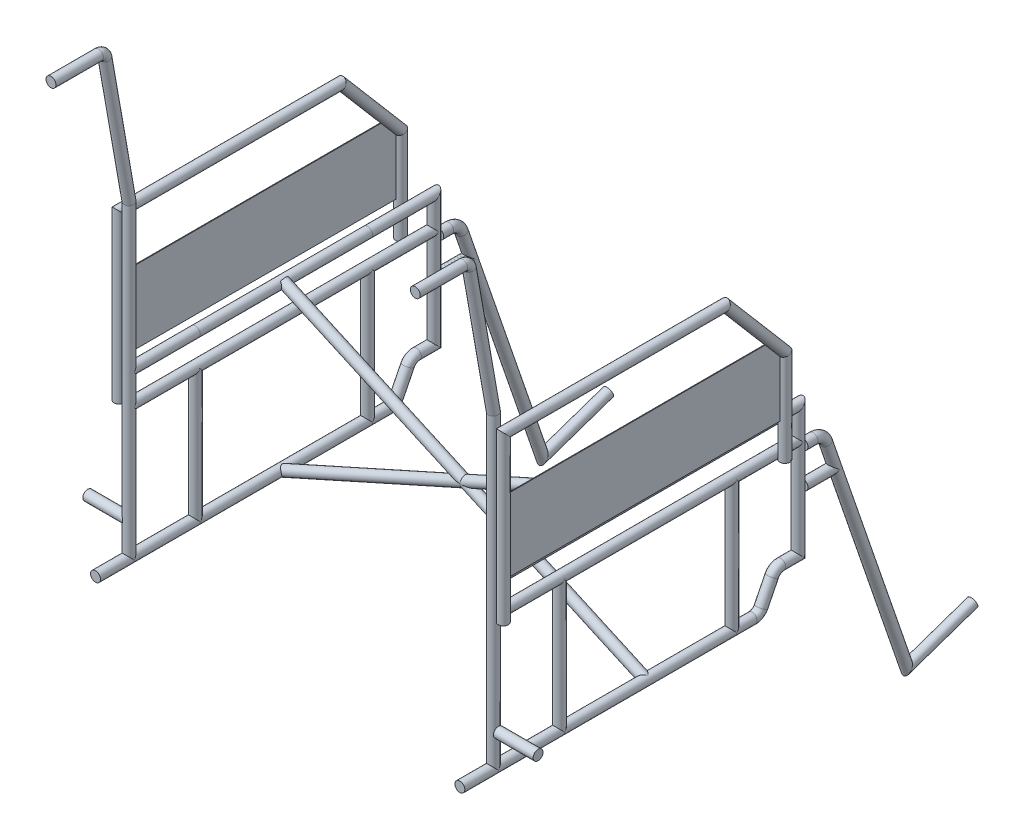
from build123d import *

# Parameters (mm, degrees)
VARREDURA1_PROFILE_R          = 7.5
RESSALTO_EXTRUS_O3_OUTLINE_R  = 7.537130279
RESSALTO_EXTRUS_O3_DEPTH      = 50.658102442
VARREDURA9_PROFILE_R          = 7.5
VARREDURA14_PROFILE_R         = 7.5
VARREDURA17_PROFILE_R         = 7.5
VARREDURA22_PROFILE_R         = 7.5
VARREDURA25_PROFILE_R         = 7.5
VARREDURA26_PROFILE_R         = 7.5
RESSALTO_EXTRUS_O5_DEPTH      = 0.55
RESSALTO_EXTRUS_O5_DEPTH_BACK = 0.55
VARREDURA28_PROFILE_R         = 7.5
VARREDURA29_PROFILE_R         = 7.5
VARREDURA37_PROFILE_R         = 7.5
VARREDURA38_PROFILE_R         = 7.5


with BuildPart() as part:
    # Varredura1: sweep along a path in Esboço1
    with BuildLine(Plane(origin=(0, 0, 0), x_dir=(0, 0, -1), z_dir=(1, 0, 0))) as varredura1_path:
        Line((0, 0), (100, 0))
        Line((100, 0), (360, 0))
        Line((360, 0), (390.738546016, 0))
        ThreePointArc((390.738546016, 0), (398.618936234, 2.236793114), (404.149086108, 8.280073331))
        Line((404.149086108, 8.280073331), (420.404466882, 40.719926669))
        ThreePointArc((420.404466882, 40.719926669), (425.934616757, 46.763206886), (433.815006974, 49))
        Line((433.815006974, 49), (460, 49))
        Line((460, 49), (460, 245))
        Line((460, 245), (360, 245))
        Line((360, 245), (100, 245))
        Line((100, 245), (0, 245))
        Line((0, 245), (0, 0))
    # Varredura1 profile (on start of the path) → Varredura1 (sweep)
    with BuildSketch(Plane(origin=(0, 0, 0), x_dir=(-1, 0, 0), z_dir=(0, 0, -1))):
        Circle(VARREDURA1_PROFILE_R)
    sweep(path=varredura1_path.line, transition=Transition.RIGHT)

    # Ressalto-extrusão3: read off the stored shape, not the designer's step
    # Ressalto-extrusão3 outline → Ressalto-extrusão3 (add)
    with BuildSketch(Plane.XY):
        Circle(RESSALTO_EXTRUS_O3_OUTLINE_R)
    extrude(amount=RESSALTO_EXTRUS_O3_DEPTH)

    # Varredura9: sweep along a path in Esboço6
    with BuildLine(Plane(origin=(0, 0, 0), x_dir=(0, 0, -1), z_dir=(1, 0, 0))) as varredura9_path:
        Line((100, 0), (100, 200.353309761))
    # Varredura9 profile (on start of the path) → Varredura9 (sweep)
    with BuildSketch(Plane(origin=(0, 0, -100), x_dir=(0, 0, 1), z_dir=(0, 1, 0))):
        Circle(VARREDURA9_PROFILE_R)
    sweep(path=varredura9_path.line)

    # Varredura14: sweep along a path in Esboço7
    with BuildLine(Plane(origin=(0, 0, 0), x_dir=(0, 0, -1), z_dir=(1, 0, 0))) as varredura14_path:
        Line((360, 0), (360, 200.014373302))
    # Varredura14 profile (on start of the path) → Varredura14 (sweep)
    with BuildSketch(Plane(origin=(0, 0, -360), x_dir=(0, 0, 1), z_dir=(0, 1, 0))):
        Circle(VARREDURA14_PROFILE_R)
    sweep(path=varredura14_path.line)

    # Varredura17: sweep along a path in Esboço242
    with BuildLine(Plane(origin=(0, 0, 0), x_dir=(0, 0, -1), z_dir=(1, 0, 0))) as varredura17_path:
        Line((0, 199.249020863), (459.296009098, 199.249020863))
    # Varredura17 profile (on start of the path) → Varredura17 (sweep)
    with BuildSketch(Plane(origin=(0, 199.249020863, 0), x_dir=(-1, 0, 0), z_dir=(0, 0, -1))):
        Circle(VARREDURA17_PROFILE_R)
    sweep(path=varredura17_path.line)

    # Varredura22: sweep along a path in Esboço279
    with BuildLine(Plane(origin=(0, 0, 0), x_dir=(0, 0, -1), z_dir=(1, 0, 0))) as varredura22_path:
        Line((0, 245), (0, 465))
        Line((0, 465), (-36.46611731, 671.809628133))
        ThreePointArc((-36.46611731, 671.809628133), (-39.886318743, 677.733590787), (-46.31419484, 680.073146356))
        Line((-46.31419484, 680.073146356), (-117.923198528, 680.073146356))
    # Varredura22 profile (on start of the path) → Varredura22 (sweep)
    with BuildSketch(Plane.ZX.offset(245)):
        Circle(VARREDURA22_PROFILE_R)
    sweep(path=varredura22_path.line, transition=Transition.RIGHT)


with BuildPart() as body_2:
    # Varredura25: sweep along a path in Esboço303
    with BuildLine(Plane(origin=(0, 0, 0), x_dir=(0, 0, -1), z_dir=(1, 0, 0))) as varredura25_path:
        Line((467.5, 136.031023838), (515.067041264, 136.031023838))
    # Varredura25 profile (on start of the path) → Varredura25 (sweep)
    with BuildSketch(Plane(origin=(0, 136.031023838, -467.5), x_dir=(-1, 0, 0), z_dir=(0, 0, -1))):
        Circle(VARREDURA25_PROFILE_R)
    sweep(path=varredura25_path.line)


with BuildPart() as body_3:
    # Varredura26: sweep along a path in Esboço294
    with BuildLine(Plane(origin=(15, 0, 0), x_dir=(0, 0, -1), z_dir=(1, 0, 0))) as varredura26_path:
        Line((424.987913504, 197.728542192), (424.987913504, 338.745926287))
        Line((424.987913504, 338.745926287), (334.34639884, 445))
        Line((334.34639884, 445), (0, 445))
        Line((0, 445), (0, 197.728542192))
    # Varredura26 profile (on start of the path) → Varredura26 (sweep)
    with BuildSketch(Plane(origin=(15, 197.728542192, -424.987913504), x_dir=(0, 0, 1), z_dir=(0, 1, 0))):
        Circle(VARREDURA26_PROFILE_R)
    sweep(path=varredura26_path.line, transition=Transition.RIGHT)


with BuildPart() as body_4:
    # Esboço325 → Ressalto-extrusão5 (new, two sides: drawn at the far end of the back side and taken through both)
    with BuildSketch(Plane(origin=(15, 0, 0), x_dir=(0, 0, -1), z_dir=(1, 0, 0)).offset(-RESSALTO_EXTRUS_O5_DEPTH_BACK)):
        Polygon((7.5, 362.571395037), (394.805064587, 362.571395037), (417.487913504, 335.981535967), (417.487913504, 251.998104881), (7.5, 252.5), align=None)
    extrude(amount=RESSALTO_EXTRUS_O5_DEPTH + RESSALTO_EXTRUS_O5_DEPTH_BACK)


with BuildPart() as body_5:
    # Corpo-Mover/Copiar1: read off the stored shape, not the designer's step
    # Corpo-Mover/Copiar1: copy of body 2
    add(body_2.part.moved(Location((-550, 0, 0))))


with BuildPart() as body_6:
    # Corpo-Mover_Copiar1 2: copy of part
    add(part.part.moved(Location((-550, 0, 0))))


with BuildPart() as part_1:
    add(part.part)

    add(body_6.part)  # Varredura28 merges body 6
    # Varredura28: sweep along a path in Esboço33
    with BuildLine(Plane.XY.offset(-230)) as varredura28_path:
        Line((0, 245.453414401), (-547.074890212, 0))
    # Varredura28 profile (on start of the path) → Varredura28 (sweep)
    with BuildSketch(Plane(origin=(0, 245.453414401, -230), x_dir=(0.40935159688576284, -0.9123767150289819, 0), z_dir=(-0.9123767150289819, -0.40935159688576284, 0))):
        Circle(VARREDURA28_PROFILE_R)
    sweep(path=varredura28_path.line)

    # Varredura29: sweep along a path in Esboço32
    with BuildLine(Plane.XY.offset(-230)) as varredura29_path:
        Line((0, 0), (-547.074890212, 246.861708637))
    # Varredura29 profile (on start of the path) → Varredura29 (sweep)
    with BuildSketch(Plane(origin=(0, 0, -230), x_dir=(-0.4113038774906765, -0.9114982832464001, 0), z_dir=(-0.9114982832464001, 0.4113038774906765, 0))):
        Circle(VARREDURA29_PROFILE_R)
    sweep(path=varredura29_path.line)


with BuildPart() as body_6_2:
    # Corpo-Mover/Copiar2: read off the stored shape, not the designer's step
    # Corpo-Mover/Copiar2: copy of body 4
    add(body_4.part.moved(Location((-580, 0, 0))))


with BuildPart() as body_7:
    # Corpo-Mover_Copiar2 2: copy of body 3
    add(body_3.part.moved(Location((-580, 0, 0))))


with BuildPart() as body_8:
    # Varredura37: sweep along a path in Esboço326
    with BuildLine(Plane.XY) as varredura37_path:
        Line((7.560028677, 50), (67.5, 50))
    # Varredura37 profile (on start of the path) → Varredura37 (sweep)
    with BuildSketch(Plane(origin=(7.560028677, 50, 0), x_dir=(0, 0, 1), z_dir=(1, 0, 0))):
        Circle(VARREDURA37_PROFILE_R)
    sweep(path=varredura37_path.line)


with BuildPart() as body_9:
    # Corpo-Mover/Copiar7: copy of body 8
    add(body_8.part.moved(Location((-620, 0, 0))))


with BuildPart() as body_2_1:
    add(body_2.part)

    # Varredura38: sweep along a path in Esboço302
    with BuildLine(Plane(origin=(0, 0, 0), x_dir=(0, 0, -1), z_dir=(1, 0, 0))) as varredura38_path:
        Line((467.5, 189.005412816), (482.576251784, 189.005412816))
        ThreePointArc((482.576251784, 189.005412816), (494.193189887, 185.285669236), (501.488924898, 175.510087725))
        Line((501.488924898, 175.510087725), (623.760247088, -180))
        Line((623.760247088, -180), (723.708457448, -145.624604608))
    # Varredura38 profile (on start of the path) → Varredura38 (sweep)
    with BuildSketch(Plane(origin=(0, 189.005412816, -467.5), x_dir=(-1, 0, 0), z_dir=(0, 0, -1))):
        Circle(VARREDURA38_PROFILE_R)
    sweep(path=varredura38_path.line, transition=Transition.RIGHT)


with BuildPart() as body_10:
    # Corpo-Mover/Copiar8: copy of body 2
    add(body_2_1.part.moved(Location((-550, 0, 0))))


solid = Compound([body_3.part, body_4.part, body_5.part, part_1.part, body_6_2.part, body_7.part, body_8.part, body_9.part, body_2_1.part, body_10.part])
